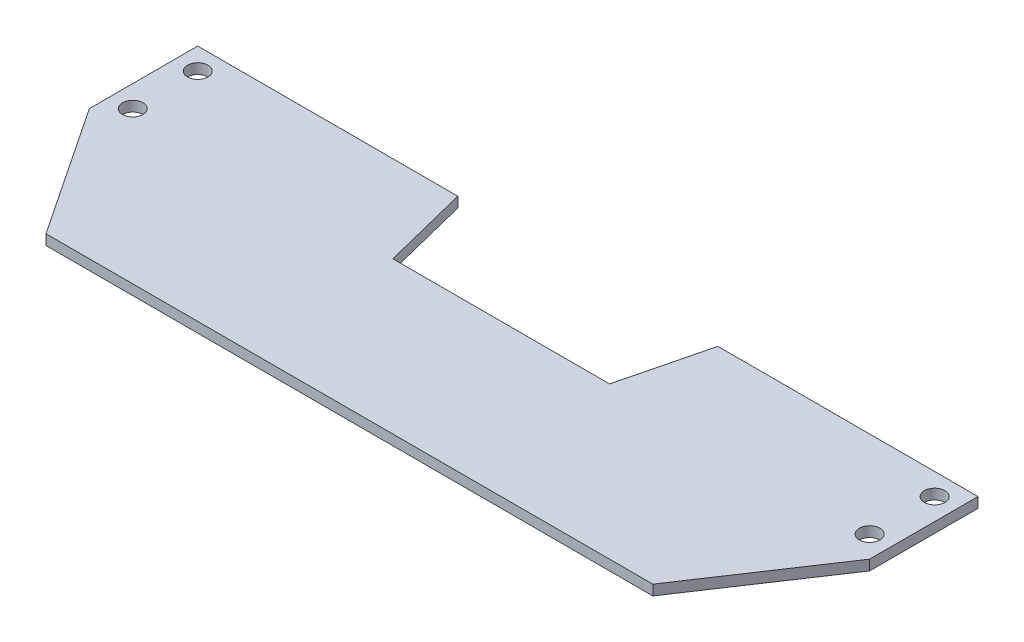
from build123d import *

# Parameters (mm, degrees)
BOSS_EXTRUDE1_DEPTH = 1.498487888
SKETCH2_R           = 1.5
CUT_EXTRUDE1_DEPTH  = 60.777143393


with BuildPart() as part:
    # Sketch1 → Boss-Extrude1 (new body)
    with BuildSketch(Plane(origin=(0, 0, 0), x_dir=(1, 0, 0), z_dir=(0, 1, 0))):
        Polygon((-57.15, 1.5875), (-44.45, -17.4625), (44.45, -17.4625), (57.15, 1.5875), (57.15, 17.4625), (19.05, 17.4625), (15.875, 4.7625), (-15.875, 4.7625), (-19.05, 17.4625), (-57.15, 17.4625), align=None)
    extrude(amount=BOSS_EXTRUDE1_DEPTH)

    # Sketch2 → Cut-Extrude1 (cut, through all)
    with BuildSketch(Plane(origin=(0, 1.498487888, 0), x_dir=(1, 0, 0), z_dir=(0, 1, 0))):
        with Locations((-53.975, 14.2875)):
            Circle(SKETCH2_R)
        with Locations((-53.975, 4.7625)):
            Circle(SKETCH2_R)
        with Locations((53.975, 4.7625)):
            Circle(SKETCH2_R)
        with Locations((53.975, 14.2875)):
            Circle(SKETCH2_R)
    extrude(amount=-CUT_EXTRUDE1_DEPTH, mode=Mode.SUBTRACT)


solid = part.part
